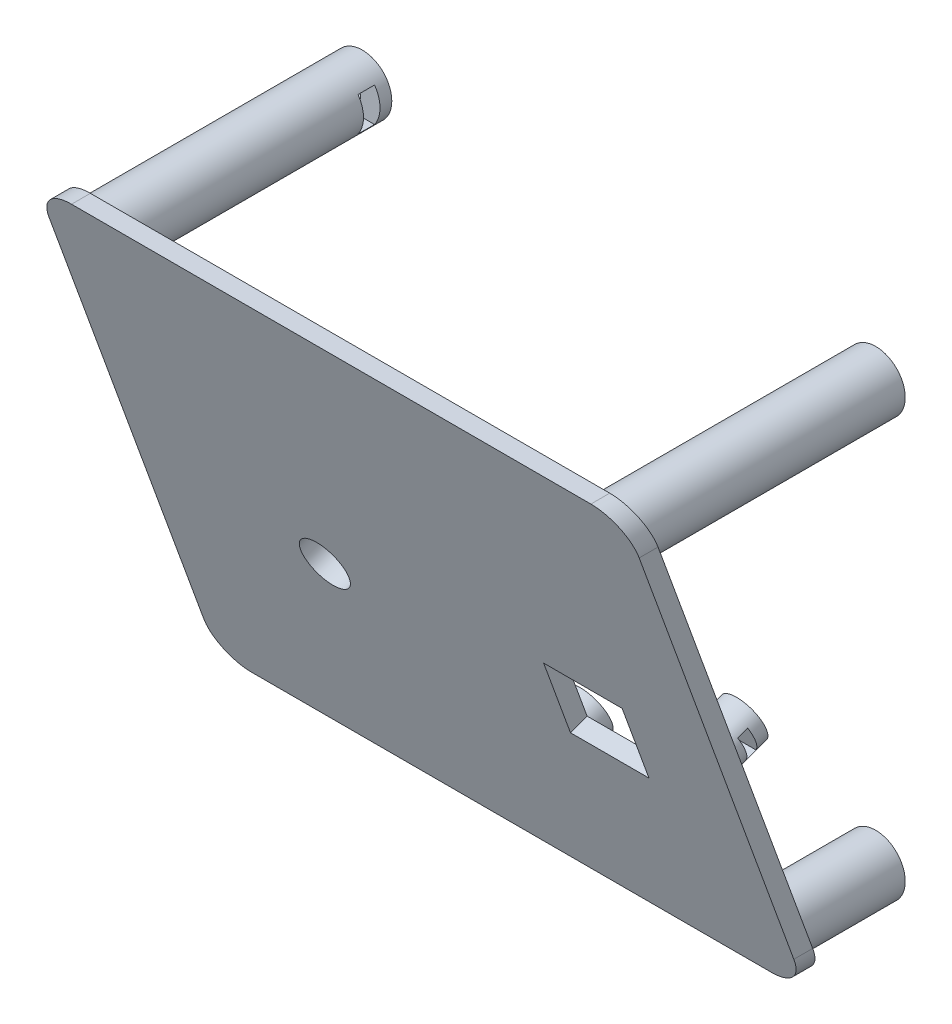
from build123d import *

# Parameters (mm, degrees)
LID_BLANK_DEPTH                 = 56
OUTER_PANEL_20DEG_DEPTH         = 143.098557347
OUTER_PANEL_20DEG_DEPTH_BACK    = 143.098557347
PANEL_3MM_DEPTH                 = 141.483885809
PANEL_3MM_DEPTH_BACK            = 141.483885809
HIDDEN_CASE_POST_0_START        = 3
SKETCH_4_R                      = 5
HIDDEN_CASE_POST_0_DEPTH        = 22.878191011
HIDDEN_CASE_POST_1_START        = 3
SKETCH_5_R                      = 5
HIDDEN_CASE_POST_1_DEPTH        = 22.878191011
HIDDEN_CASE_POST_2_START        = 3
SKETCH_6_R                      = 5
HIDDEN_CASE_POST_2_DEPTH        = 48.720077644
HIDDEN_CASE_POST_3_START        = 3
SKETCH_7_R                      = 5
HIDDEN_CASE_POST_3_DEPTH        = 48.720077644
FLUSH_OUTER_SURFACE_DEPTH       = 141.483885809
FLUSH_OUTER_SURFACE_DEPTH_BACK  = 141.483885809
BLIND_M3_0_START                = 3
SKETCH_9_R                      = 1.7
BLIND_M3_0_DEPTH                = 9.5
BLIND_M3_1_START                = 3
SKETCH_11_R                     = 1.7
BLIND_M3_1_DEPTH                = 9.5
BLIND_M3_2_START                = 3
SKETCH_13_R                     = 1.7
BLIND_M3_2_DEPTH                = 9.5
BLIND_M3_3_START                = 3
SKETCH_15_R                     = 1.7
BLIND_M3_3_DEPTH                = 9.5
SKETCH_17_R                     = 4.1
SHAFT_D8P2_DEPTH                = 5
SKETCH_18_W                     = 13.3
SKETCH_18_H                     = 13.3
BUTTON_13P3_CLEARANCE_DEPTH     = 5
SKETCH_19_R                     = 4
ENCODER_RIGHT_BLIND_POST_DEPTH  = 11.07
ENCODER_RIGHT_BLIND_SCREW_START = -14.07
SKETCH_20_R                     = 1.15
ENCODER_RIGHT_BLIND_SCREW_DEPTH = 5
SKETCH_22_R                     = 4
ENCODER_LEFT_BLIND_POST_DEPTH   = 11.07
ENCODER_LEFT_BLIND_SCREW_START  = -14.07
SKETCH_23_R                     = 1.15
ENCODER_LEFT_BLIND_SCREW_DEPTH  = 5
SKETCH_25_R                     = 4
BUTTON_LEFT_BLIND_POST_DEPTH    = 6.7
BUTTON_LEFT_BLIND_SCREW_START   = -9.7
SKETCH_26_R                     = 1.15
BUTTON_LEFT_BLIND_SCREW_DEPTH   = 5
SKETCH_28_R                     = 3.8
BUTTON_RIGHT_BLIND_POST_DEPTH   = 6.7
BUTTON_RIGHT_BLIND_SCREW_START  = -9.7
SKETCH_29_R                     = 1.15
BUTTON_RIGHT_BLIND_SCREW_DEPTH  = 5
M3_HEX_SIDE_NUT_0_START         = 5
M3_HEX_SIDE_NUT_0_DEPTH         = 2.8
M3_HEX_SIDE_NUT_1_START         = 5
M3_HEX_SIDE_NUT_1_DEPTH         = 2.8
M3_HEX_SIDE_NUT_2_START         = 5
M3_HEX_SIDE_NUT_2_DEPTH         = 2.8
M3_HEX_SIDE_NUT_3_START         = 5
M3_HEX_SIDE_NUT_3_DEPTH         = 2.8
ENCODER_RIGHT_HEX_M2_NUT_START  = -10.27
ENCODER_RIGHT_HEX_M2_NUT_DEPTH  = 1.8
ENCODER_LEFT_HEX_M2_NUT_START   = -10.27
ENCODER_LEFT_HEX_M2_NUT_DEPTH   = 1.8
BUTTON_LEFT_HEX_M2_NUT_START    = -5.9
BUTTON_LEFT_HEX_M2_NUT_DEPTH    = 1.8
BUTTON_RIGHT_HEX_M2_NUT_START   = -5.9
BUTTON_RIGHT_HEX_M2_NUT_DEPTH   = 1.8


with BuildPart() as part:
    # 草图1 → Lid_blank (new body)
    with BuildSketch(Plane.XY):
        with BuildLine():
            Line((6, 0), (94, 0))
            ThreePointArc((94, 0), (98.242640687, 1.757359313), (100, 6))
            Line((100, 6), (100, 78))
            ThreePointArc((100, 78), (98.242640687, 82.242640687), (94, 84))
            Line((94, 84), (6, 84))
            ThreePointArc((6, 84), (1.757359313, 82.242640687), (0, 78))
            Line((0, 78), (0, 6))
            ThreePointArc((0, 6), (1.757359313, 1.757359313), (6, 0))
        make_face()
    extrude(amount=LID_BLANK_DEPTH)

    # 草图2 → Outer_panel_20deg (cut, two sides: drawn at the far end of the back side and taken through both)
    with BuildSketch(Plane(origin=(0, 0, 0), x_dir=(0, 0, -1), z_dir=(1, 0, 0)).offset(-OUTER_PANEL_20DEG_DEPTH_BACK)):
        Polygon((-13.913128632, -20), (-61.229259087, 110), (-120, 110), (-120, -20), align=None)
    extrude(amount=OUTER_PANEL_20DEG_DEPTH + OUTER_PANEL_20DEG_DEPTH_BACK, mode=Mode.SUBTRACT)

    # 草图3 → Panel_3mm (cut, two sides: drawn at the far end of the back side and taken through both)
    with BuildSketch(Plane(origin=(0, 0, 0), x_dir=(0, 0, -1), z_dir=(1, 0, 0)).offset(-PANEL_3MM_DEPTH_BACK)):
        Polygon((-10.720595315, -20), (-58.036725769, 110), (30, 110), (30, -20), align=None)
    extrude(amount=PANEL_3MM_DEPTH + PANEL_3MM_DEPTH_BACK, mode=Mode.SUBTRACT)

    # 草图4 → Hidden_case_post_0 (add)
    with BuildSketch(Plane.XY.offset(HIDDEN_CASE_POST_0_START)):
        with Locations((6.5, 6.5)):
            Circle(SKETCH_4_R)
    extrude(amount=HIDDEN_CASE_POST_0_DEPTH)

    # 草图5 → Hidden_case_post_1 (add)
    with BuildSketch(Plane.XY.offset(HIDDEN_CASE_POST_1_START)):
        with Locations((93.5, 6.5)):
            Circle(SKETCH_5_R)
    extrude(amount=HIDDEN_CASE_POST_1_DEPTH)

    # 草图6 → Hidden_case_post_2 (add)
    with BuildSketch(Plane.XY.offset(HIDDEN_CASE_POST_2_START)):
        with Locations((6.5, 77.5)):
            Circle(SKETCH_6_R)
    extrude(amount=HIDDEN_CASE_POST_2_DEPTH)

    # 草图7 → Hidden_case_post_3 (add)
    with BuildSketch(Plane.XY.offset(HIDDEN_CASE_POST_3_START)):
        with Locations((93.5, 77.5)):
            Circle(SKETCH_7_R)
    extrude(amount=HIDDEN_CASE_POST_3_DEPTH)

    # 草图8 → Flush_outer_surface (cut, two sides: drawn at the far end of the back side and taken through both)
    with BuildSketch(Plane(origin=(0, 0, 0), x_dir=(0, 0, -1), z_dir=(1, 0, 0)).offset(-FLUSH_OUTER_SURFACE_DEPTH_BACK)):
        Polygon((-13.913128632, -20), (-61.229259087, 110), (-120, 110), (-120, -20), align=None)
    extrude(amount=FLUSH_OUTER_SURFACE_DEPTH + FLUSH_OUTER_SURFACE_DEPTH_BACK, mode=Mode.SUBTRACT)

    # 草图9 → Blind_M3_0 (cut)
    with BuildSketch(Plane.XY.offset(BLIND_M3_0_START)):
        with Locations((6.5, 6.5)):
            Circle(SKETCH_9_R)
    extrude(amount=BLIND_M3_0_DEPTH, mode=Mode.SUBTRACT)

    # 草图11 → Blind_M3_1 (cut)
    with BuildSketch(Plane.XY.offset(BLIND_M3_1_START)):
        with Locations((93.5, 6.5)):
            Circle(SKETCH_11_R)
    extrude(amount=BLIND_M3_1_DEPTH, mode=Mode.SUBTRACT)

    # 草图13 → Blind_M3_2 (cut)
    with BuildSketch(Plane.XY.offset(BLIND_M3_2_START)):
        with Locations((6.5, 77.5)):
            Circle(SKETCH_13_R)
    extrude(amount=BLIND_M3_2_DEPTH, mode=Mode.SUBTRACT)

    # 草图15 → Blind_M3_3 (cut)
    with BuildSketch(Plane.XY.offset(BLIND_M3_3_START)):
        with Locations((93.5, 77.5)):
            Circle(SKETCH_15_R)
    extrude(amount=BLIND_M3_3_DEPTH, mode=Mode.SUBTRACT)

    # 草图17 → Shaft_D8p2 (cut)
    with BuildSketch(Plane(origin=(0, -6.811148917, 18.71347785), x_dir=(1, 0, 0), z_dir=(0, -0.3420201433256689, 0.9396926207859084))):
        with Locations((31, 44.248273283)):
            Circle(SKETCH_17_R)
    extrude(amount=-SHAFT_D8P2_DEPTH, mode=Mode.SUBTRACT)

    # 草图18 → Button_13p3_clearance (cut)
    with BuildSketch(Plane(origin=(0, -6.811148917, 18.71347785), x_dir=(1, 0, 0), z_dir=(0, -0.3420201433256689, 0.9396926207859084))):
        with Locations((77, 44.248273283)):
            Rectangle(SKETCH_18_W, SKETCH_18_H)
    extrude(amount=-BUTTON_13P3_CLEARANCE_DEPTH, mode=Mode.SUBTRACT)

    # 草图19 → Encoder_right_blind_post (add)
    with BuildSketch(Plane(origin=(0, -5.785088487, 15.894399988), x_dir=(-1, 0, 0), z_dir=(0, 0.34202014332566866, -0.9396926207859085))):
        with Locations((-44.5, 36.248273283)):
            Circle(SKETCH_19_R)
    extrude(amount=ENCODER_RIGHT_BLIND_POST_DEPTH)

    # 草图20 → Encoder_right_blind_screw (cut)
    with BuildSketch(Plane(origin=(0, -6.811148917, 18.71347785), x_dir=(1, 0, 0), z_dir=(0, -0.3420201433256689, 0.9396926207859084)).offset(ENCODER_RIGHT_BLIND_SCREW_START)):
        with Locations((44.5, 36.248273283)):
            Circle(SKETCH_20_R)
    extrude(amount=ENCODER_RIGHT_BLIND_SCREW_DEPTH, mode=Mode.SUBTRACT)

    # 草图22 → Encoder_left_blind_post (add)
    with BuildSketch(Plane(origin=(0, -5.785088487, 15.894399988), x_dir=(-1, 0, 0), z_dir=(0, 0.34202014332566866, -0.9396926207859085))):
        with Locations((-17.5, 60.248273283)):
            Circle(SKETCH_22_R)
    extrude(amount=ENCODER_LEFT_BLIND_POST_DEPTH)

    # 草图23 → Encoder_left_blind_screw (cut)
    with BuildSketch(Plane(origin=(0, -6.811148917, 18.71347785), x_dir=(1, 0, 0), z_dir=(0, -0.3420201433256689, 0.9396926207859084)).offset(ENCODER_LEFT_BLIND_SCREW_START)):
        with Locations((17.5, 60.248273283)):
            Circle(SKETCH_23_R)
    extrude(amount=ENCODER_LEFT_BLIND_SCREW_DEPTH, mode=Mode.SUBTRACT)

    # 草图25 → Button_left_blind_post (add)
    with BuildSketch(Plane(origin=(0, -5.785088487, 15.894399988), x_dir=(-1, 0, 0), z_dir=(0, 0.34202014332566866, -0.9396926207859085))):
        with Locations((-60, 25.248273283)):
            Circle(SKETCH_25_R)
    extrude(amount=BUTTON_LEFT_BLIND_POST_DEPTH)

    # 草图26 → Button_left_blind_screw (cut)
    with BuildSketch(Plane(origin=(0, -6.811148917, 18.71347785), x_dir=(1, 0, 0), z_dir=(0, -0.3420201433256689, 0.9396926207859084)).offset(BUTTON_LEFT_BLIND_SCREW_START)):
        with Locations((60, 25.248273283)):
            Circle(SKETCH_26_R)
    extrude(amount=BUTTON_LEFT_BLIND_SCREW_DEPTH, mode=Mode.SUBTRACT)

    # 草图28 → Button_right_blind_post (add)
    with BuildSketch(Plane(origin=(0, -5.785088487, 15.894399988), x_dir=(-1, 0, 0), z_dir=(0, 0.34202014332566866, -0.9396926207859085))):
        with Locations((-93.3, 45.248273283)):
            Circle(SKETCH_28_R)
    extrude(amount=BUTTON_RIGHT_BLIND_POST_DEPTH)

    # 草图29 → Button_right_blind_screw (cut)
    with BuildSketch(Plane(origin=(0, -6.811148917, 18.71347785), x_dir=(1, 0, 0), z_dir=(0, -0.3420201433256689, 0.9396926207859084)).offset(BUTTON_RIGHT_BLIND_SCREW_START)):
        with Locations((93.3, 45.248273283)):
            Circle(SKETCH_29_R)
    extrude(amount=BUTTON_RIGHT_BLIND_SCREW_DEPTH, mode=Mode.SUBTRACT)

    # M3_hex_side_nut_0_Sketch → M3_hex_side_nut_0 (cut)
    with BuildSketch(Plane.XY.offset(M3_HEX_SIDE_NUT_0_START)):
        Polygon((3.151368439, 6.5), (4.825684219, 3.6), (14.5, 3.6), (14.5, 9.4), (4.825684219, 9.4), align=None)
    extrude(amount=M3_HEX_SIDE_NUT_0_DEPTH, mode=Mode.SUBTRACT)

    # M3_hex_side_nut_1_Sketch → M3_hex_side_nut_1 (cut)
    with BuildSketch(Plane.XY.offset(M3_HEX_SIDE_NUT_1_START)):
        Polygon((96.848631561, 6.5), (95.174315781, 3.6), (85.5, 3.6), (85.5, 9.4), (95.174315781, 9.4), align=None)
    extrude(amount=M3_HEX_SIDE_NUT_1_DEPTH, mode=Mode.SUBTRACT)

    # M3_hex_side_nut_2_Sketch → M3_hex_side_nut_2 (cut)
    with BuildSketch(Plane.XY.offset(M3_HEX_SIDE_NUT_2_START)):
        Polygon((3.151368439, 77.5), (4.825684219, 74.6), (14.5, 74.6), (14.5, 80.4), (4.825684219, 80.4), align=None)
    extrude(amount=M3_HEX_SIDE_NUT_2_DEPTH, mode=Mode.SUBTRACT)

    # M3_hex_side_nut_3_Sketch → M3_hex_side_nut_3 (cut)
    with BuildSketch(Plane.XY.offset(M3_HEX_SIDE_NUT_3_START)):
        Polygon((96.848631561, 77.5), (95.174315781, 74.6), (85.5, 74.6), (85.5, 80.4), (95.174315781, 80.4), align=None)
    extrude(amount=M3_HEX_SIDE_NUT_3_DEPTH, mode=Mode.SUBTRACT)

    # Encoder_right_hex_M2_nut_Sketch → Encoder_right_hex_M2_nut (cut)
    with BuildSketch(Plane(origin=(0, -6.811148917, 18.71347785), x_dir=(1, 0, 0), z_dir=(0, -0.3420201433256689, 0.9396926207859084)).offset(ENCODER_RIGHT_HEX_M2_NUT_START)):
        Polygon((42.075128869, 36.248273283), (43.287564435, 34.148273283), (52.5, 34.148273283), (52.5, 38.348273283), (43.287564435, 38.348273283), align=None)
    extrude(amount=-ENCODER_RIGHT_HEX_M2_NUT_DEPTH, mode=Mode.SUBTRACT)

    # Encoder_left_hex_M2_nut_Sketch → Encoder_left_hex_M2_nut (cut)
    with BuildSketch(Plane(origin=(0, -6.811148917, 18.71347785), x_dir=(1, 0, 0), z_dir=(0, -0.3420201433256689, 0.9396926207859084)).offset(ENCODER_LEFT_HEX_M2_NUT_START)):
        Polygon((15.075128869, 60.248273283), (16.287564435, 58.148273283), (25.5, 58.148273283), (25.5, 62.348273283), (16.287564435, 62.348273283), align=None)
    extrude(amount=-ENCODER_LEFT_HEX_M2_NUT_DEPTH, mode=Mode.SUBTRACT)

    # Button_left_hex_M2_nut_Sketch → Button_left_hex_M2_nut (cut)
    with BuildSketch(Plane(origin=(0, -6.811148917, 18.71347785), x_dir=(1, 0, 0), z_dir=(0, -0.3420201433256689, 0.9396926207859084)).offset(BUTTON_LEFT_HEX_M2_NUT_START)):
        Polygon((57.575128869, 25.248273283), (58.787564435, 23.148273283), (68, 23.148273283), (68, 27.348273283), (58.787564435, 27.348273283), align=None)
    extrude(amount=-BUTTON_LEFT_HEX_M2_NUT_DEPTH, mode=Mode.SUBTRACT)

    # Button_right_hex_M2_nut_Sketch → Button_right_hex_M2_nut (cut)
    with BuildSketch(Plane(origin=(0, -6.811148917, 18.71347785), x_dir=(1, 0, 0), z_dir=(0, -0.3420201433256689, 0.9396926207859084)).offset(BUTTON_RIGHT_HEX_M2_NUT_START)):
        Polygon((90.875128869, 45.248273283), (92.087564435, 43.148273283), (101.3, 43.148273283), (101.3, 47.348273283), (92.087564435, 47.348273283), align=None)
    extrude(amount=-BUTTON_RIGHT_HEX_M2_NUT_DEPTH, mode=Mode.SUBTRACT)


solid = part.part
